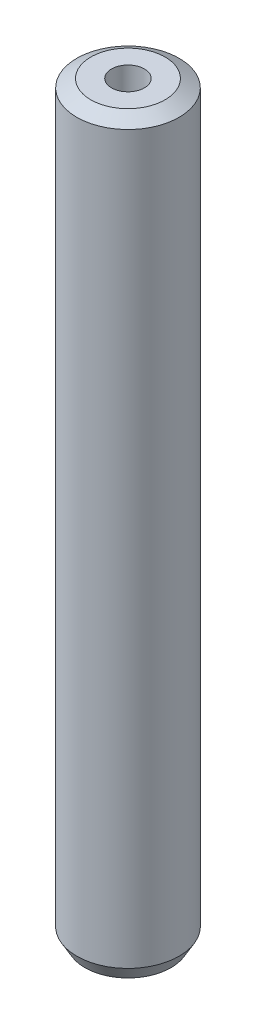
from build123d import *
from OCP.BRepFilletAPI import BRepFilletAPI_MakeChamfer

# Parameters (mm, degrees)
SKETCH1_R           = 25
BOSS_EXTRUDE1_DEPTH = 365.803524565
SKETCH2_R           = 8.037403324
CUT_EXTRUDE1_DEPTH  = 368.508120433
CHAMFER1_SIZE       = 3.963685013
CHAMFER1_SIZE2      = 6.865303828


with BuildPart() as part:
    # Sketch1 → Boss-Extrude1 (new body)
    with BuildSketch(Plane(origin=(0, 0, 0), x_dir=(1, 0, 0), z_dir=(0, 1, 0))):
        Circle(SKETCH1_R)
    extrude(amount=BOSS_EXTRUDE1_DEPTH)

    # Sketch2 → Cut-Extrude1 (cut, through all)
    with BuildSketch(Plane(origin=(0, 0, 0), x_dir=(1, 0, 0), z_dir=(0, 1, 0))):
        Circle(SKETCH2_R)
    extrude(amount=CUT_EXTRUDE1_DEPTH, mode=Mode.SUBTRACT)

    # Chamfer1: one chamfer whose edges measure the first distance from different faces: ONE call of the kernel's chamfer builder (chamfer() names one face for all edges)
    chamfer1_edges_1 = [part.edges().sort_by_distance(p)[0] for p in [
        (-25, 365.803524565, 0),
    ]]
    chamfer1_side_1 = [part.faces().sort_by_distance(p)[0] for p in [
        (-25, 182.901762283, 0),
    ]]
    chamfer1_edges_2 = [part.edges().sort_by_distance(p)[0] for p in [
        (-25, 0, 0),
    ]]
    chamfer1_side_2 = [part.faces().sort_by_distance(p)[0] for p in [
        (-24.292893219, 0, 0),
    ]]
    chamfer1 = BRepFilletAPI_MakeChamfer(part.part.solid().wrapped)
    for e in chamfer1_edges_1:
        chamfer1.Add(CHAMFER1_SIZE, CHAMFER1_SIZE2, e.wrapped, chamfer1_side_1[0].wrapped)  # the first distance lies on this face
    for e in chamfer1_edges_2:
        chamfer1.Add(CHAMFER1_SIZE, CHAMFER1_SIZE2, e.wrapped, chamfer1_side_2[0].wrapped)  # the first distance lies on this face
    add(Compound.cast(chamfer1.Shape()), mode=Mode.REPLACE)


solid = part.part
